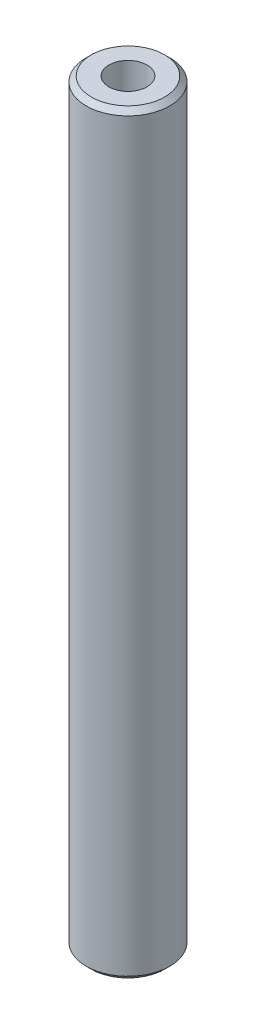
from build123d import *

# Parameters (mm, degrees)
SKETCH1_R           = 5
BOSS_EXTRUDE1_DEPTH = 90.410552009
SKETCH2_R           = 2.277783023
CUT_EXTRUDE1_DEPTH  = 91.686646837
CHAMFER1_SIZE       = 0.614040155


with BuildPart() as part:
    # Sketch1 → Boss-Extrude1 (new body)
    with BuildSketch(Plane(origin=(0, 0, 0), x_dir=(1, 0, 0), z_dir=(0, 1, 0))):
        Circle(SKETCH1_R)
    extrude(amount=BOSS_EXTRUDE1_DEPTH)

    # Sketch2 → Cut-Extrude1 (cut, through all)
    with BuildSketch(Plane(origin=(0, 0, 0), x_dir=(1, 0, 0), z_dir=(0, 1, 0))):
        Circle(SKETCH2_R)
    extrude(amount=CUT_EXTRUDE1_DEPTH, mode=Mode.SUBTRACT)

    # Chamfer1
    chamfer1_edges = [part.edges().sort_by_distance(p)[0] for p in [
        (-5, 90.410552009, 0),
        (-5, 0, 0),
    ]]
    chamfer(chamfer1_edges, length=CHAMFER1_SIZE)


solid = part.part
